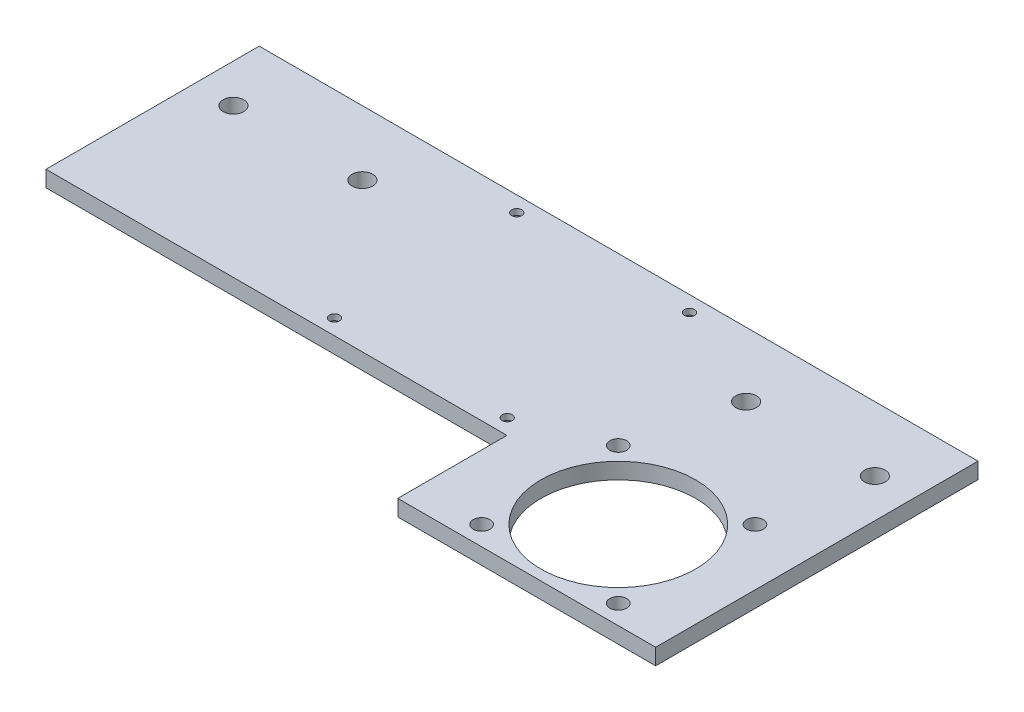
from build123d import *

# Parameters (mm, degrees)
SKETCH1_W               = 40
SKETCH1_H               = 42
BOSS_EXTRUDE1_DEPTH     = 3.175
SKETCH2_R               = 1
CUT_EXTRUDE1_DEPTH      = 30.173286154
SKETCH3_W               = 50.8
SKETCH3_H               = 63.5
BOSS_EXTRUDE2_DEPTH     = 3.175
SKETCH4_R               = 2.032
CUT_EXTRUDE2_DEPTH      = 83.637586031
SKETCH7_R               = 2.5
CUT_EXTRUDE4_DEPTH      = 2
SKETCH8_R               = 1.651
CUT_EXTRUDE5_DEPTH      = 83.637586031
SKETCH9_R               = 15.24
CUT_EXTRUDE6_DEPTH      = 83.637586031
CUT_EXTRUDE7_DEPTH      = 83.637586031
CUT_EXTRUDE7_DEPTH_BACK = 83.637586031
SKETCH10_W              = 50.8
SKETCH10_H              = 21.5


with BuildPart() as part:
    # Sketch1 → Boss-Extrude1 (new body)
    with BuildSketch(Plane(origin=(0, 0, 0), x_dir=(1, 0, 0), z_dir=(0, 1, 0))):
        Rectangle(SKETCH1_W, SKETCH1_H)
    extrude(amount=BOSS_EXTRUDE1_DEPTH)

    # Sketch2 → Cut-Extrude1 (cut, through all)
    with BuildSketch(Plane(origin=(0, 3.175, 0), x_dir=(1, 0, 0), z_dir=(0, 1, 0))):
        with Locations((17.015999872, -17.952)):
            Circle(SKETCH2_R)
        with Locations((-17.015999872, -17.952)):
            Circle(SKETCH2_R)
        with Locations((17.015999872, 17.952)):
            Circle(SKETCH2_R)
        with Locations((-17.015999872, 17.952)):
            Circle(SKETCH2_R)
    extrude(amount=-CUT_EXTRUDE1_DEPTH, mode=Mode.SUBTRACT)

    # Sketch3 → Boss-Extrude2 (add)
    with BuildSketch(Plane(origin=(0, 3.175, 0), x_dir=(1, 0, 0), z_dir=(0, 1, 0))):
        with Locations((45.4, -10.75)):
            Rectangle(SKETCH3_W, SKETCH3_H)
        with Locations((-45.4, -10.75)):
            Rectangle(SKETCH3_W, SKETCH3_H)
    extrude(amount=-BOSS_EXTRUDE2_DEPTH)

    # Sketch4 → Cut-Extrude2 (cut, through all)
    with BuildSketch(Plane(origin=(0, 3.175, 0), x_dir=(1, 0, 0), z_dir=(0, 1, 0))):
        with Locations((63.18, 8.3)):
            Circle(SKETCH4_R)
        with Locations((37.814543867, 8.3)):
            Circle(SKETCH4_R)
        with Locations((-37.78, 8.3)):
            Circle(SKETCH4_R)
        with Locations((-63.18, 8.3)):
            Circle(SKETCH4_R)
    extrude(amount=-CUT_EXTRUDE2_DEPTH, mode=Mode.SUBTRACT)

    # Sketch7 → Cut-Extrude4 (cut)
    with BuildSketch(Plane.XZ):
        with Locations((-17.015999872, 17.952)):
            Circle(SKETCH7_R)
        with Locations((17.015999872, 17.952)):
            Circle(SKETCH7_R)
        with Locations((17.015999872, -17.952)):
            Circle(SKETCH7_R)
        with Locations((-17.015999872, -17.952)):
            Circle(SKETCH7_R)
    extrude(amount=-CUT_EXTRUDE4_DEPTH, mode=Mode.SUBTRACT)

    # Sketch8 → Cut-Extrude5 (cut, through all)
    with BuildSketch(Plane(origin=(0, 0, 0), x_dir=(-1, 0, 0), z_dir=(0, -1, 0))):
        with Locations((-32.7, -38.69)):
            Circle(SKETCH8_R)
        with Locations((-32.7, -11.766)):
            Circle(SKETCH8_R)
        with Locations((-59.624, -38.69)):
            Circle(SKETCH8_R)
        with Locations((-59.624, -11.766)):
            Circle(SKETCH8_R)
    extrude(amount=-CUT_EXTRUDE5_DEPTH, mode=Mode.SUBTRACT)

    # Sketch9 → Cut-Extrude6 (cut, through all)
    with BuildSketch(Plane(origin=(0, 0, 0), x_dir=(-1, 0, 0), z_dir=(0, -1, 0))):
        with Locations((-46.162, -25.228)):
            Circle(SKETCH9_R)
    extrude(amount=-CUT_EXTRUDE6_DEPTH, mode=Mode.SUBTRACT)

    # Sketch10 → Cut-Extrude7 (cut, two sides: drawn at the far end of the back side and taken through both)
    with BuildSketch(Plane(origin=(0, 3.175, 0), x_dir=(1, 0, 0), z_dir=(0, 1, 0)).offset(-CUT_EXTRUDE7_DEPTH_BACK)):
        with Locations((-45.4, -31.75)):
            Rectangle(SKETCH10_W, SKETCH10_H)
    extrude(amount=CUT_EXTRUDE7_DEPTH + CUT_EXTRUDE7_DEPTH_BACK, mode=Mode.SUBTRACT)


solid = part.part
